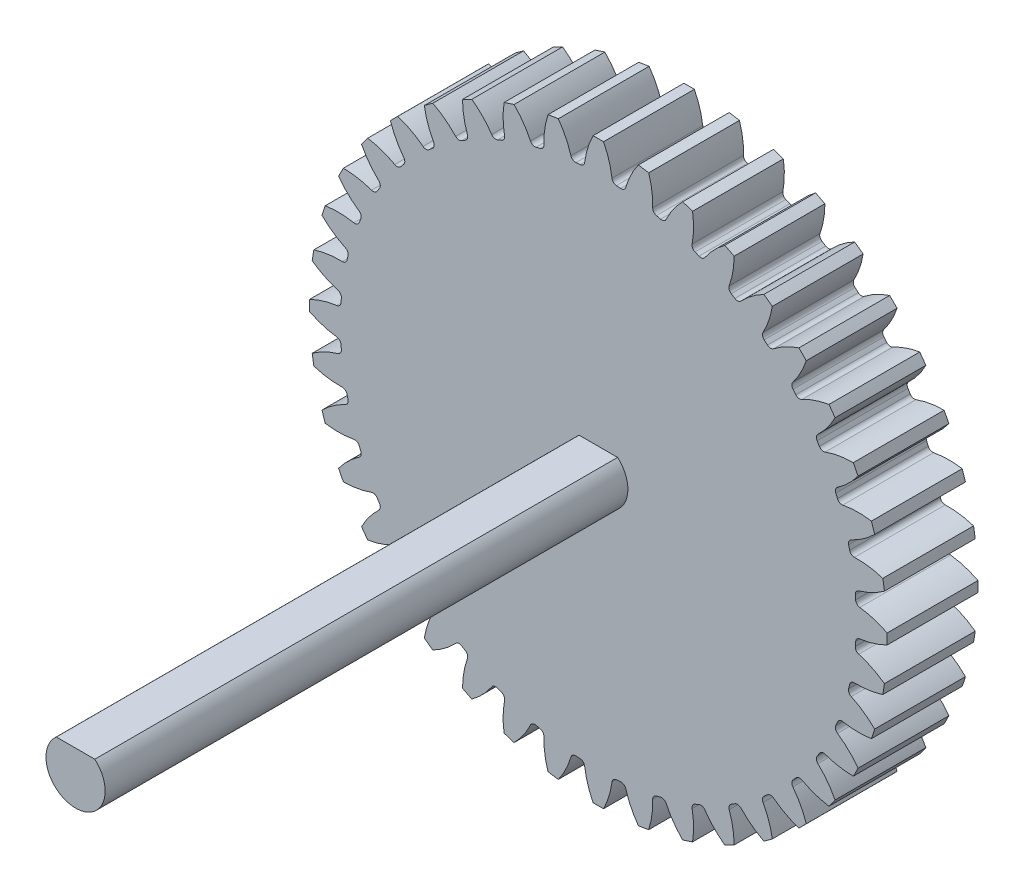
from build123d import *

# Parameters (mm, degrees)
ESQUISSE1_R                        = 1.15
BASE_EXTRUSION_DEPTH               = 2.5
BOSS_EXTRU_1_DEPTH                 = 3.3
CONG_1_R                           = 0.175
R_P_TITION_CIRCULAIRE4_COUNT       = 40
CONG_1_OF_R_P_TITION_CIRCULAIRE4_R = 0.175
BOSS_EXTRU_2_DEPTH                 = 19
ESQUISSE5_R                        = 1
ENL_V_MAT_EXTRU_1_DEPTH            = 3
BOSS_EXTRU_3_START                 = 3
ESQUISSE6_R                        = 2
ESQUISSE6_R_2                      = 1
BOSS_EXTRU_3_DEPTH                 = 3


with BuildPart() as part:
    # Esquisse1 → Base-Extrusion (new body)
    with BuildSketch(Plane.XY):
        Circle(ESQUISSE1_R)
    extrude(amount=BASE_EXTRUSION_DEPTH)

    # Esquisse3 → Boss.-Extru.1 (add)
    with BuildSketch(Plane.XY):
        with BuildLine():
            Line((-0.735554022, 9.346100004), (0, 0))
            Line((0, 0), (0.735554022, 9.346100004))
            ThreePointArc((0.735554022, 9.346100004), (0.623147079, 9.354267086), (0.510650079, 9.361082282))
            ThreePointArc((0.510650079, 9.361082282), (0.406217794, 9.945410374), (0.190155724, 10.498277992))
            ThreePointArc((0.190155724, 10.498277992), (0, 10.5), (-0.190155724, 10.498277992))
            ThreePointArc((-0.190155724, 10.498277992), (-0.406217794, 9.945410374), (-0.510650079, 9.361082282))
            ThreePointArc((-0.510650079, 9.361082282), (-0.623147079, 9.354267086), (-0.735554022, 9.346100004))
        make_face()
    boss_extru_1 = extrude(amount=BOSS_EXTRU_1_DEPTH)

    # Congé1
    cong_1_edges = [part.edges().sort_by_distance(p)[0] for p in [
        (0.510650079, 9.361082282, 1.65),
        (-0.510650079, 9.361082282, 1.65),
    ]]
    fillet(cong_1_edges, radius=CONG_1_R)

    # Répétition circulaire4: Boss.-Extru.1 ×40 about axis
    r_p_tition_circulaire4_axis = Axis((0, 0, 0), (0, 0, 1))
    for i in range(1, R_P_TITION_CIRCULAIRE4_COUNT):
        add(boss_extru_1.rotate(r_p_tition_circulaire4_axis, i * 360 / R_P_TITION_CIRCULAIRE4_COUNT))

    # Congé1 of Répétition circulaire4
    cong_1_of_r_p_tition_circulaire4_edges = [part.edges().sort_by_distance(p)[0] for p in [
        (-0.96003277, 9.325715098, 1.65),
        (-1.968759028, 9.165948554, 1.65),
        (-2.407076426, 9.060717857, 1.65),
        (-3.378390596, 8.745118752, 1.65),
        (-3.794849872, 8.572615672, 1.65),
        (-4.704834975, 8.108955103, 1.65),
        (-5.089181519, 7.873427238, 1.65),
        (-5.915430703, 7.273122067, 1.65),
        (-6.258200628, 6.980368895, 1.65),
        (-6.980368895, 6.258200628, 1.65),
        (-7.273122067, 5.915430703, 1.65),
        (-7.873427238, 5.089181519, 1.65),
        (-8.108955103, 4.704834975, 1.65),
        (-8.572615672, 3.794849872, 1.65),
        (-8.745118752, 3.378390596, 1.65),
        (-9.060717857, 2.407076426, 1.65),
        (-9.165948554, 1.968759028, 1.65),
        (-9.325715098, 0.96003277, 1.65),
        (-9.361082282, 0.510650079, 1.65),
        (-9.361082282, -0.510650079, 1.65),
        (-9.325715098, -0.96003277, 1.65),
        (-9.165948554, -1.968759028, 1.65),
        (-9.060717857, -2.407076426, 1.65),
        (-8.745118752, -3.378390596, 1.65),
        (-8.572615672, -3.794849872, 1.65),
        (-8.108955103, -4.704834975, 1.65),
        (-7.873427238, -5.089181519, 1.65),
        (-7.273122067, -5.915430703, 1.65),
        (-6.980368895, -6.258200628, 1.65),
        (-6.258200628, -6.980368895, 1.65),
        (-5.915430703, -7.273122067, 1.65),
        (-5.089181519, -7.873427238, 1.65),
        (-4.704834975, -8.108955103, 1.65),
        (-3.794849872, -8.572615672, 1.65),
        (-3.378390596, -8.745118752, 1.65),
        (-2.407076426, -9.060717857, 1.65),
        (-1.968759028, -9.165948554, 1.65),
        (-0.96003277, -9.325715098, 1.65),
        (-0.510650079, -9.361082282, 1.65),
        (0.510650079, -9.361082282, 1.65),
        (0.96003277, -9.325715098, 1.65),
        (1.968759028, -9.165948554, 1.65),
        (2.407076426, -9.060717857, 1.65),
        (3.378390596, -8.745118752, 1.65),
        (3.794849872, -8.572615672, 1.65),
        (4.704834975, -8.108955103, 1.65),
        (5.089181519, -7.873427238, 1.65),
        (5.915430703, -7.273122067, 1.65),
        (6.258200628, -6.980368895, 1.65),
        (6.980368895, -6.258200628, 1.65),
        (7.273122067, -5.915430703, 1.65),
        (7.873427238, -5.089181519, 1.65),
        (8.108955103, -4.704834975, 1.65),
        (8.572615672, -3.794849872, 1.65),
        (8.745118752, -3.378390596, 1.65),
        (9.060717857, -2.407076426, 1.65),
        (9.165948554, -1.968759028, 1.65),
        (9.325715098, -0.96003277, 1.65),
        (9.361082282, -0.510650079, 1.65),
        (9.361082282, 0.510650079, 1.65),
        (9.325715098, 0.96003277, 1.65),
        (9.165948554, 1.968759028, 1.65),
        (9.060717857, 2.407076426, 1.65),
        (8.745118752, 3.378390596, 1.65),
        (8.572615672, 3.794849872, 1.65),
        (8.108955103, 4.704834975, 1.65),
        (7.873427238, 5.089181519, 1.65),
        (7.273122067, 5.915430703, 1.65),
        (6.980368895, 6.258200628, 1.65),
        (6.258200628, 6.980368895, 1.65),
        (5.915430703, 7.273122067, 1.65),
        (5.089181519, 7.873427238, 1.65),
        (4.704834975, 8.108955103, 1.65),
        (3.794849872, 8.572615672, 1.65),
        (3.378390596, 8.745118752, 1.65),
        (2.407076426, 9.060717857, 1.65),
        (1.968759028, 9.165948554, 1.65),
        (0.96003277, 9.325715098, 1.65),
    ]]
    fillet(cong_1_of_r_p_tition_circulaire4_edges, radius=CONG_1_OF_R_P_TITION_CIRCULAIRE4_R)

    # Esquisse4 → Boss.-Extru.2 (add)
    with BuildSketch(Plane.XY.offset(3.3)):
        with BuildLine():
            Line((-0.7, 0.815858444), (0.7, 0.815858444))
            ThreePointArc((0.7, 0.815858444), (0, -1.075), (-0.7, 0.815858444))
        make_face()
    extrude(amount=BOSS_EXTRU_2_DEPTH)

    # Esquisse5 → Enlèv. mat.-Extru.1 (cut)
    with BuildSketch(Plane(origin=(0, 0, 0), x_dir=(-1, 0, 0), z_dir=(0, 0, -1))):
        Circle(ESQUISSE5_R)
    extrude(amount=-ENL_V_MAT_EXTRU_1_DEPTH, mode=Mode.SUBTRACT)

    # Esquisse6 → Boss.-Extru.3 (add)
    with BuildSketch(Plane(origin=(0, 0, 0), x_dir=(-1, 0, 0), z_dir=(0, 0, -1)).offset(BOSS_EXTRU_3_START)):
        with Locations(Location((0, 0, 0), (0, 0, 180))):
            Circle(ESQUISSE6_R)
        Circle(ESQUISSE6_R_2, mode=Mode.SUBTRACT)
    extrude(amount=-BOSS_EXTRU_3_DEPTH)


solid = part.part
